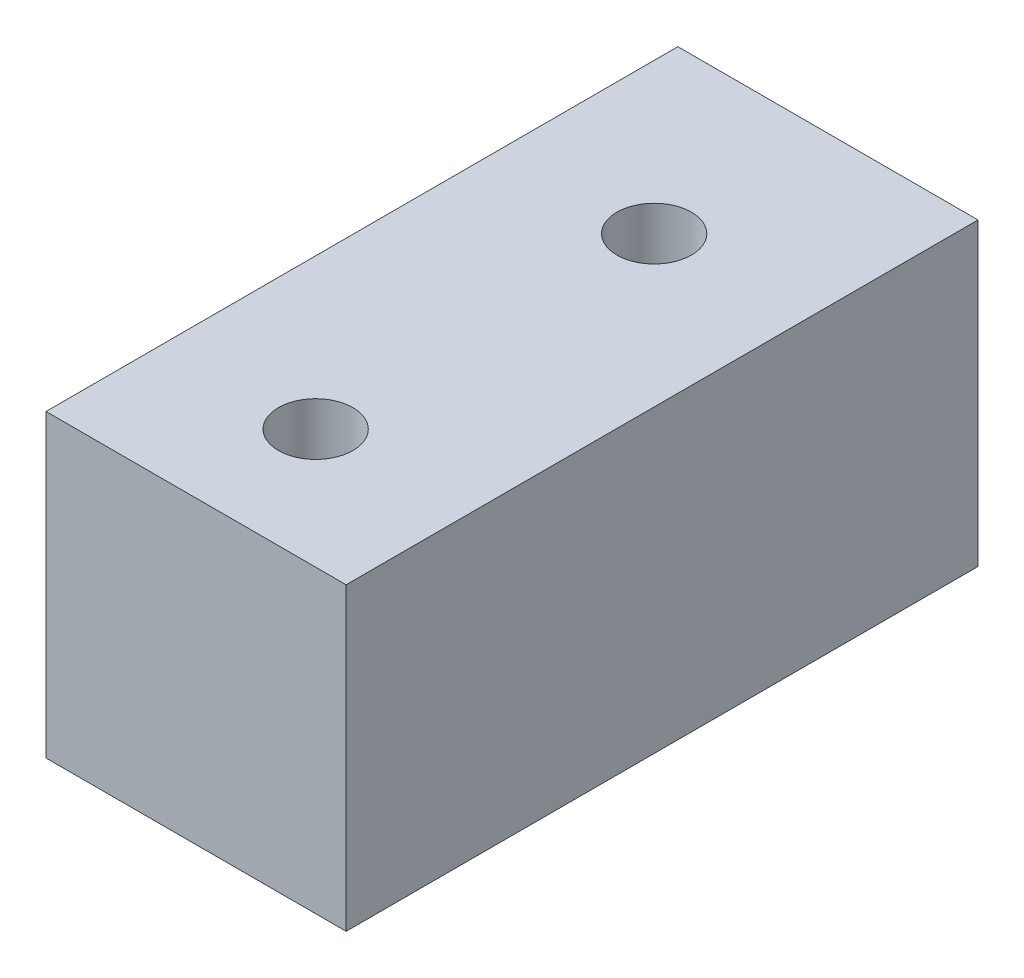
from build123d import *

# Parameters (mm, degrees)
SKETCH_1_W          = 13.3
SKETCH_1_H          = 13.3
EXTRUDE_1_DEPTH     = 28
SKETCH_2_R          = 1.65
CUT_EXTRUDE_1_DEPTH = 32.703509269


with BuildPart() as part:
    # Эскиз1 → Бобышка-Вытянуть1 (new body)
    with BuildSketch(Plane.XY):
        Rectangle(SKETCH_1_W, SKETCH_1_H)
    extrude(amount=EXTRUDE_1_DEPTH)

    # Эскиз2 → Вырез-Вытянуть1 (cut, through all)
    with BuildSketch(Plane(origin=(0, 6.65, 0), x_dir=(1, 0, 0), z_dir=(0, 1, 0))):
        with Locations((0, -7.7)):
            Circle(SKETCH_2_R)
        with Locations((0, -22.7)):
            Circle(SKETCH_2_R)
    extrude(amount=-CUT_EXTRUDE_1_DEPTH, mode=Mode.SUBTRACT)


solid = part.part
